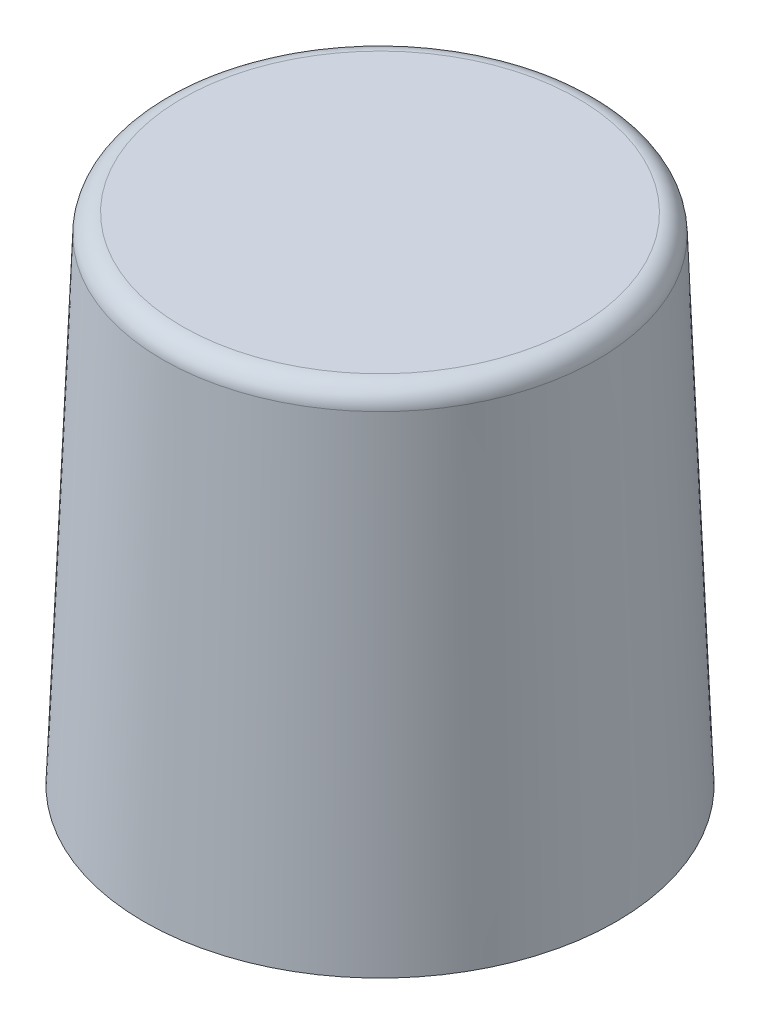
from build123d import *

# Parameters (mm, degrees)
FILLET1_R = 0.25


with BuildPart() as part:
    # Sketch1 → Revolve1 (revolve)
    with BuildSketch(Plane.XY):
        Polygon((0, 0), (2.75, 0), (3, -6.3), (1.5, -6.3), (1.5, -0.3), (0, -0.3), align=None)
    revolve(axis=Axis((0, 0, 0), (0, 1, 0)))

    # Fillet1
    fillet1_edges = [part.edges().sort_by_distance(p)[0] for p in [
        (-2.75, 0, 0),
    ]]
    fillet(fillet1_edges, radius=FILLET1_R)


solid = part.part
